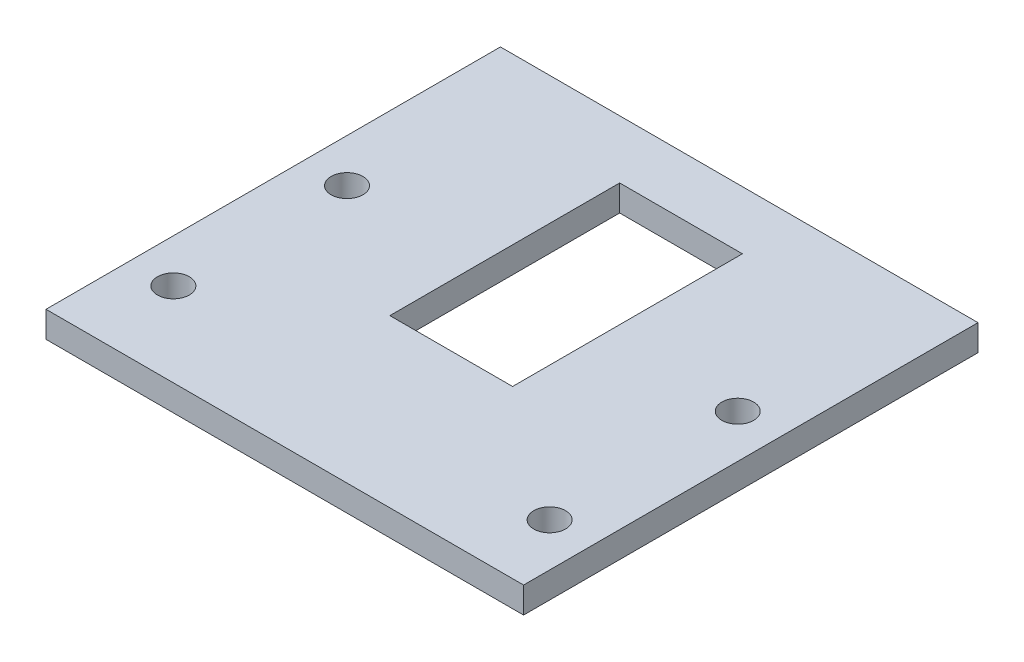
from build123d import *

# Parameters (mm, degrees)
SKETCH5_W      = 41.91
SKETCH5_H      = 39.878
SKETCH5_R      = 1.397
EXTRUDE3_DEPTH = 2.286
SKETCH6_W      = 10.7696
SKETCH6_H      = 20.1676
EXTRUDE4_DEPTH = 58.895844238


with BuildPart() as part:
    # Sketch5 → Extrude3 (new body)
    with BuildSketch(Plane(origin=(0, 0, 0), x_dir=(1, 0, 0), z_dir=(0, 1, 0))):
        with Locations((-20.955, -19.939)):
            Rectangle(SKETCH5_W, SKETCH5_H)
        with Locations((-38.1, -17.272)):
            Circle(SKETCH5_R, mode=Mode.SUBTRACT)
        with Locations((-38.1, -32.512)):
            Circle(SKETCH5_R, mode=Mode.SUBTRACT)
        with Locations((-3.81, -33.782)):
            Circle(SKETCH5_R, mode=Mode.SUBTRACT)
        with Locations((-3.81, -17.272)):
            Circle(SKETCH5_R, mode=Mode.SUBTRACT)
    extrude(amount=EXTRUDE3_DEPTH)

    # Sketch6 → Extrude4 (cut, through all)
    with BuildSketch(Plane(origin=(0, 2.286, 0), x_dir=(-1, 0, 0), z_dir=(0, 1, 0))):
        with Locations((20.955, 15.1892)):
            Rectangle(SKETCH6_W, SKETCH6_H)
    extrude(amount=-EXTRUDE4_DEPTH, mode=Mode.SUBTRACT)


solid = part.part
